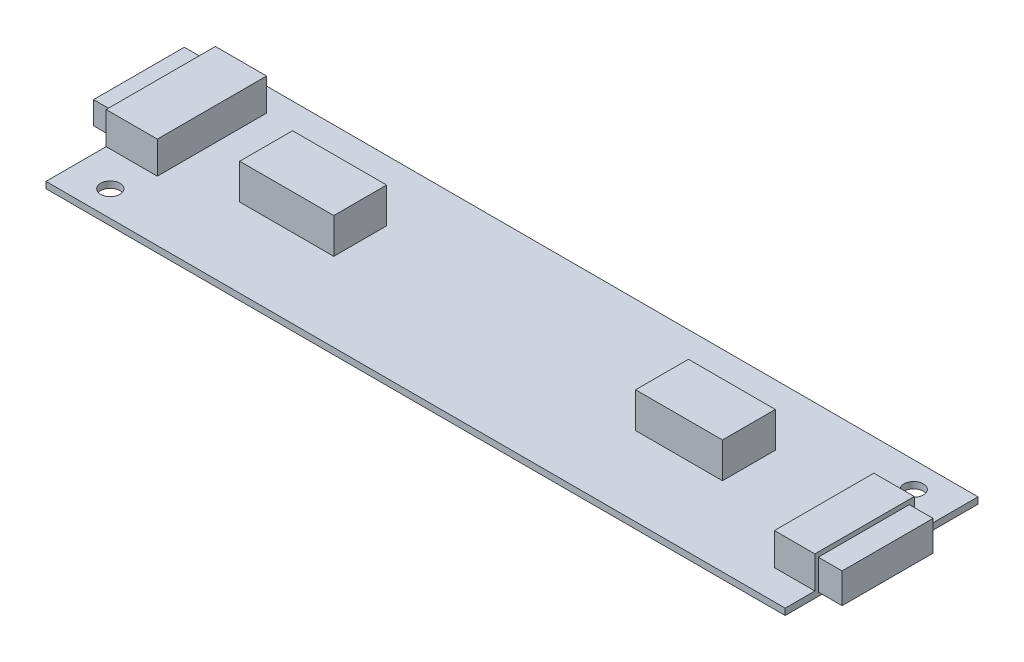
from build123d import *

# Parameters (mm, degrees)
SKETCH1_W              = 115
SKETCH1_H              = 30
EXTRUDE1_DEPTH         = 1
SKETCH2_R              = 1.5
MOUNT_HOLES_CUT_DEPTH  = 1
SKETCH4_W              = 13.516297105
SKETCH4_H              = 8.221252878
SKETCH4_W_2            = 14.631043257
INDUCTORS_DEPTH        = 5.5
SKETCH5_W              = 6.291348601
SKETCH5_H              = 15.467102872
SKETCH5_W_2            = 7.96346783
SKETCH5_H_2            = 16.999878832
CCFL_CONN_DEPTH        = 5
SKETCH6_W              = 14.156835531
SKETCH6_H              = 4.690856218
MATE_STICK_OUT_1_DEPTH = 3.7
SKETCH7_W              = 14.117118553
SKETCH7_H              = 3.532074628
MATE_STICK_OUT_2_DEPTH = 3.7


with BuildPart() as part:
    # Sketch1 → Extrude1 (new body)
    with BuildSketch(Plane(origin=(0, 0, 0), x_dir=(1, 0, 0), z_dir=(0, 1, 0))):
        with Locations((57.5, -15)):
            Rectangle(SKETCH1_W, SKETCH1_H)
    extrude(amount=EXTRUDE1_DEPTH)

    # Sketch2 → mount holes - cut (cut)
    with BuildSketch(Plane(origin=(0, 1, 0), x_dir=(-1, 0, 0), z_dir=(0, 1, 0))):
        with Locations((-109, 4)):
            Circle(SKETCH2_R)
        with Locations((-6, 26)):
            Circle(SKETCH2_R)
    extrude(amount=-MOUNT_HOLES_CUT_DEPTH, mode=Mode.SUBTRACT)

    # Sketch4 → inductors (add)
    with BuildSketch(Plane(origin=(0, 1, 0), x_dir=(-1, 0, 0), z_dir=(0, 1, 0))):
        with Locations((-86.204713438, 13.606567309)):
            Rectangle(SKETCH4_W, SKETCH4_H)
        with Locations((-25.172361566, 13.606567309)):
            Rectangle(SKETCH4_W_2, SKETCH4_H)
    extrude(amount=INDUCTORS_DEPTH)

    # Sketch5 → ccfl conn (add)
    with BuildSketch(Plane(origin=(0, 1, 0), x_dir=(-1, 0, 0), z_dir=(0, 1, 0))):
        with Locations((-111.8543257, 17.647522113)):
            Rectangle(SKETCH5_W, SKETCH5_H)
        with Locations((-3.981733915, 12.143462983)):
            Rectangle(SKETCH5_W_2, SKETCH5_H_2)
    extrude(amount=CCFL_CONN_DEPTH)

    # Sketch6 → mate stick-out 1 (add)
    with BuildSketch(Plane(origin=(115, 0, 0), x_dir=(0, 0, -1), z_dir=(1, 0, 0))):
        with Locations((-17.7667625, 2.941021447)):
            Rectangle(SKETCH6_W, SKETCH6_H)
    extrude(amount=MATE_STICK_OUT_1_DEPTH)

    # Sketch7 → mate stick-out 2 (add)
    with BuildSketch(Plane.ZY):
        with Locations((11.841645931, 2.849567483)):
            Rectangle(SKETCH7_W, SKETCH7_H)
    extrude(amount=MATE_STICK_OUT_2_DEPTH)


solid = part.part
